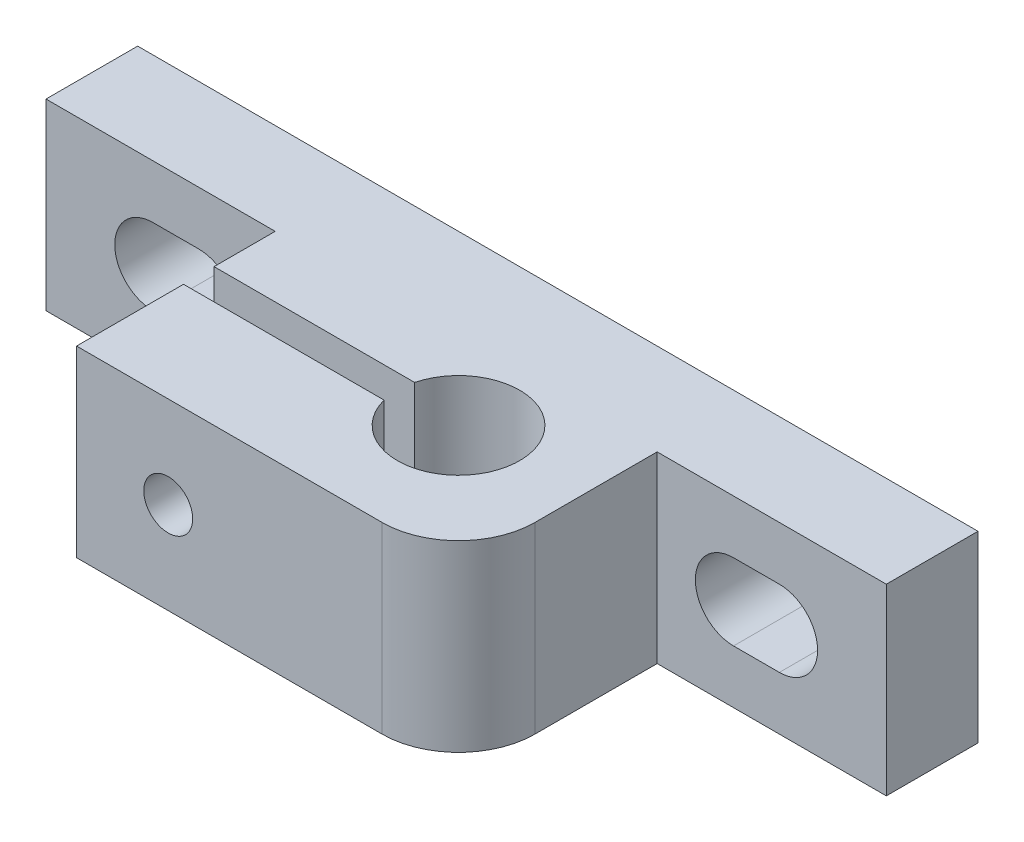
from build123d import *

# Parameters (mm, degrees)
SKETCH2_W           = 55
SKETCH2_H           = 12
BOSS_EXTRUDE1_DEPTH = 6
SKETCH3_W           = 25
SKETCH3_H           = 12
BOSS_EXTRUDE2_DEPTH = 13
FILLET1_R           = 5
CUT_EXTRUDE2_DEPTH  = 30
SKETCH5_W           = 20.513890507
SKETCH5_H           = 7
CUT_EXTRUDE3_DEPTH  = 5
SKETCH6_R           = 1.6
CUT_EXTRUDE4_DEPTH  = 20
CUT_EXTRUDE5_DEPTH  = 3


with BuildPart() as part:
    # Sketch2 → Boss-Extrude1 (new body)
    with BuildSketch(Plane.XY):
        with Locations((27.5, 6)):
            Rectangle(SKETCH2_W, SKETCH2_H)
        with BuildLine():
            Line((7, 8.5), (10, 8.5))
            ThreePointArc((10, 8.5), (12.5, 6), (10, 3.5))
            Line((10, 3.5), (7, 3.5))
            ThreePointArc((7, 3.5), (4.5, 6), (7, 8.5))
        make_face(mode=Mode.SUBTRACT)
        with BuildLine():
            Line((48, 8.5), (45, 8.5))
            ThreePointArc((45, 8.5), (42.5, 6), (45, 3.5))
            Line((45, 3.5), (48, 3.5))
            ThreePointArc((48, 3.5), (50.5, 6), (48, 8.5))
        make_face(mode=Mode.SUBTRACT)
    extrude(amount=BOSS_EXTRUDE1_DEPTH)

    # Sketch3 → Boss-Extrude2 (add)
    with BuildSketch(Plane.XY.offset(6)):
        with Locations((27.5, 6)):
            Rectangle(SKETCH3_W, SKETCH3_H)
    extrude(amount=BOSS_EXTRUDE2_DEPTH)

    # Fillet1
    fillet1_edges = [part.edges().sort_by_distance(p)[0] for p in [
        (40, 6, 19),
    ]]
    fillet(fillet1_edges, radius=FILLET1_R)

    # Sketch4 → Cut-Extrude2 (cut)
    with BuildSketch(Plane.XZ):
        with BuildLine():
            Line((15, 10), (28.127016654, 10))
            ThreePointArc((28.127016654, 10), (36, 11), (28.127016654, 12))
            Line((28.127016654, 12), (15, 12))
            Line((15, 12), (15, 10))
        make_face()
    extrude(amount=-CUT_EXTRUDE2_DEPTH, mode=Mode.SUBTRACT)

    # Sketch5 → Cut-Extrude3 (cut)
    with BuildSketch(Plane(origin=(0, 0, 0), x_dir=(-1, 0, 0), z_dir=(0, 0, -1))):
        with Locations((-27.415473723, 6)):
            Rectangle(SKETCH5_W, SKETCH5_H)
    extrude(amount=-CUT_EXTRUDE3_DEPTH, mode=Mode.SUBTRACT)

    # Sketch6 → Cut-Extrude4 (cut)
    with BuildSketch(Plane.XY.offset(19)):
        with Locations((21, 6)):
            Circle(SKETCH6_R)
    extrude(amount=-CUT_EXTRUDE4_DEPTH, mode=Mode.SUBTRACT)

    # Sketch7 → Cut-Extrude5 (cut)
    with BuildSketch(Plane(origin=(0, 0, 5), x_dir=(-1, 0, 0), z_dir=(0, 0, -1))):
        Polygon((-17.535898385, 6), (-19.267949192, 9), (-22.732050808, 9), (-24.464101615, 6), (-22.732050808, 3), (-19.267949192, 3), align=None)
    extrude(amount=-CUT_EXTRUDE5_DEPTH, mode=Mode.SUBTRACT)


solid = part.part
